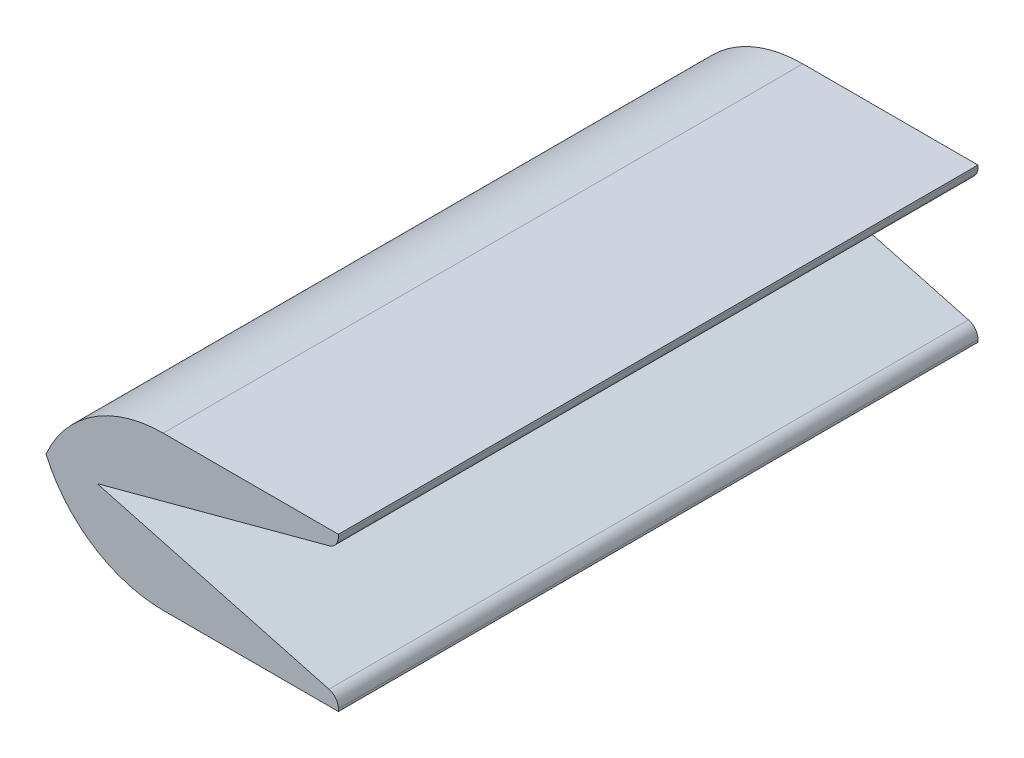
from build123d import *

# Parameters (mm, degrees)
BOSS_EXTRUDE1_DEPTH     = 50
BOSS_EXTRUDE2_DEPTH     = 50
CUT_EXTRUDE1_DEPTH      = 56.88006898
CUT_EXTRUDE1_DEPTH_BACK = 56.88006898
SKETCH3_W               = 15
SKETCH3_H               = 0.75
FILLET1_DEPTH           = 50
FILLET2_DEPTH           = 50
FILLET3_R               = 1


with BuildPart() as part:
    # Sketch1 → Boss-Extrude1 (new body)
    with BuildSketch(Plane.XY):
        Polygon((-4, -2), (16.92820323, -2), (16.92820323, -1.053536475), (-1.931851653, 4), (16.92820323, 9.053536475), (16.92820323, 10), (-4, 10), align=None)
    extrude(amount=BOSS_EXTRUDE1_DEPTH)

    # Sketch2 → Boss-Extrude2 (add)
    with BuildSketch(Plane.XY.offset(50)):
        Polygon((-5.931851653, 4), (-4, 10), (-4, -2), align=None)
    extrude(amount=-BOSS_EXTRUDE2_DEPTH)

    # Sketch3 → Cut-Extrude1 (cut, two sides: drawn at the far end of the back side and taken through both)
    with BuildSketch(Plane(origin=(-5.931851653, 0, 0), x_dir=(0, 0, -1), z_dir=(1, 0, 0)).offset(-CUT_EXTRUDE1_DEPTH_BACK)):
        with Locations((-25, 3.625)):
            Rectangle(SKETCH3_W, SKETCH3_H)
        with Locations((-25, 4.375)):
            Rectangle(SKETCH3_W, SKETCH3_H)
    extrude(amount=CUT_EXTRUDE1_DEPTH + CUT_EXTRUDE1_DEPTH_BACK, mode=Mode.SUBTRACT)

    # Fillet1: read off the stored shape, not the designer's step
    # Fillet1 outline → Fillet1 (cut)
    with BuildSketch(Plane.XY):
        with BuildLine():
            ThreePointArc((-5.931851653, 4), (-2.243925838, 8.366600265), (3.233299737, 10))
            Line((3.233299737, 10), (-4, 10))
            Line((-4, 10), (-5.931851653, 4))
        make_face()
    extrude(amount=FILLET1_DEPTH, mode=Mode.SUBTRACT)

    # Fillet2: read off the stored shape, not the designer's step
    # Fillet2 outline → Fillet2 (cut)
    with BuildSketch(Plane.XY):
        with BuildLine():
            ThreePointArc((3.233299737, -2), (-2.243925838, -0.366600265), (-5.931851653, 4))
            Line((-5.931851653, 4), (-4, -2))
            Line((-4, -2), (3.233299737, -2))
        make_face()
    extrude(amount=FILLET2_DEPTH, mode=Mode.SUBTRACT)

    # Fillet3
    fillet3_edges = [part.edges().sort_by_distance(p)[0] for p in [
        (16.92820323, -1.053536475, 25),
        (16.92820323, 9.053536475, 25),
    ]]
    fillet(fillet3_edges, radius=FILLET3_R)


solid = part.part
